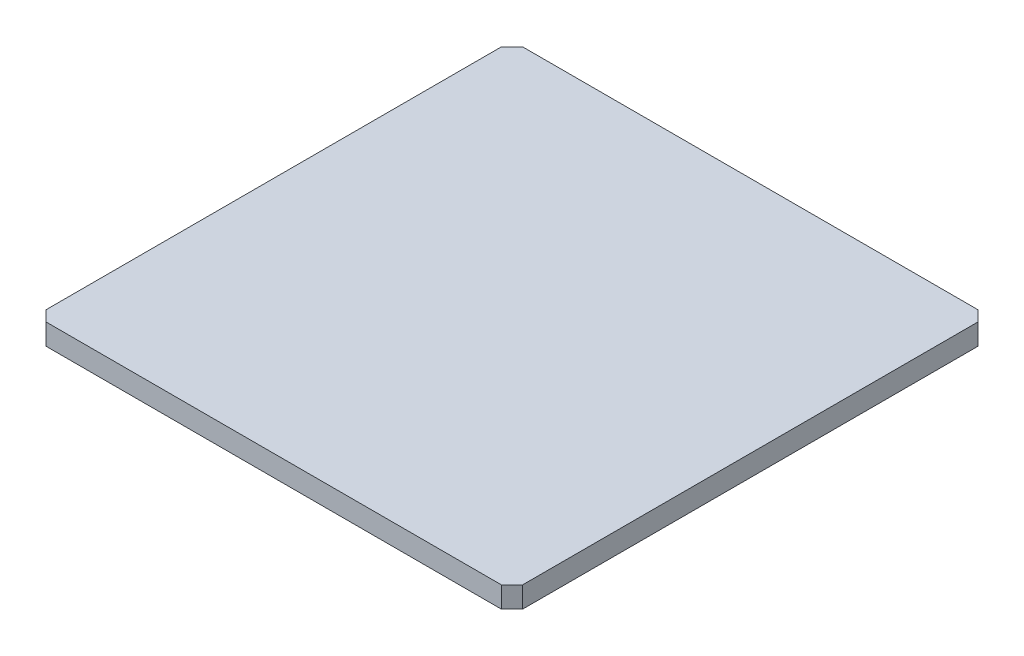
from build123d import *

# Parameters (mm, degrees)
SKETCH2_W           = 113.13708499
SKETCH2_H           = 113.13708499
BOSS_EXTRUDE1_DEPTH = 5
CHAMFER1_SIZE       = 2.5


with BuildPart() as part:
    # Sketch2 → Boss-Extrude1 (new body)
    with BuildSketch(Plane(origin=(0, 0, 0), x_dir=(1, 0, 0), z_dir=(0, 1, 0))):
        Rectangle(SKETCH2_W, SKETCH2_H)
    extrude(amount=BOSS_EXTRUDE1_DEPTH)

    # Chamfer1
    chamfer1_edges = [part.edges().sort_by_distance(p)[0] for p in [
        (-56.568542495, 2.5, 56.568542495),
        (56.568542495, 2.5, 56.568542495),
        (56.568542495, 2.5, -56.568542495),
        (-56.568542495, 2.5, -56.568542495),
    ]]
    chamfer(chamfer1_edges, length=CHAMFER1_SIZE)


solid = part.part
